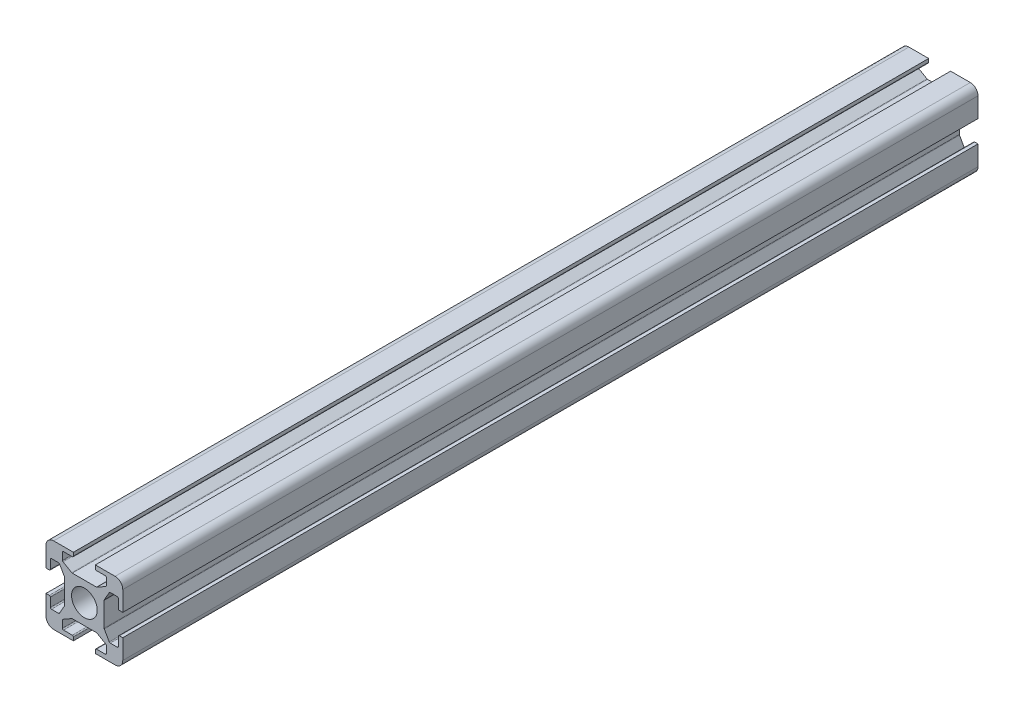
from build123d import *

# Parameters (mm, degrees)
CROQUIS1_R              = 5.85
SALIENTE_EXTRUIR1_DEPTH = 390


with BuildPart() as part:
    # Croquis1 → Saliente-Extruir1 (new body)
    with BuildSketch(Plane.XY):
        with BuildLine():
            Line((-16, -5), (-17.5, -5))
            Line((-17.5, -5), (-17.5, -14))
            ThreePointArc((-17.5, -14), (-16.474873734, -16.474873734), (-14, -17.5))
            Line((-14, -17.5), (-5, -17.5))
            Line((-5, -17.5), (-5, -16))
            ThreePointArc((-5, -16), (-5.146446609, -15.646446609), (-5.5, -15.5))
            Line((-5.5, -15.5), (-9.5, -15.5))
            ThreePointArc((-9.5, -15.5), (-9.853553391, -15.353553391), (-10, -15))
            Line((-10, -15), (-10, -11.790147321))
            ThreePointArc((-10, -11.790147321), (-9.932460283, -11.539192936), (-9.748087586, -11.356036103))
            Line((-9.748087586, -11.356036103), (-5.740718013, -9.065888782))
            ThreePointArc((-5.740718013, -9.065888782), (-5.620974478, -9.016752854), (-5.492630427, -9))
            Line((-5.492630427, -9), (5.492630427, -9))
            ThreePointArc((5.492630427, -9), (5.620974478, -9.016752854), (5.740718013, -9.065888782))
            Line((5.740718013, -9.065888782), (9.748087586, -11.356036103))
            ThreePointArc((9.748087586, -11.356036103), (9.932460283, -11.539192936), (10, -11.790147321))
            Line((10, -11.790147321), (10, -15))
            ThreePointArc((10, -15), (9.853553391, -15.353553391), (9.5, -15.5))
            Line((9.5, -15.5), (5.5, -15.5))
            ThreePointArc((5.5, -15.5), (5.146446609, -15.646446609), (5, -16))
            Line((5, -16), (5, -17.5))
            Line((5, -17.5), (14, -17.5))
            ThreePointArc((14, -17.5), (16.474873734, -16.474873734), (17.5, -14))
            Line((17.5, -14), (17.5, -5))
            Line((17.5, -5), (16, -5))
            ThreePointArc((16, -5), (15.646446609, -5.146446609), (15.5, -5.5))
            Line((15.5, -5.5), (15.5, -9.5))
            ThreePointArc((15.5, -9.5), (15.353553391, -9.853553391), (15, -10))
            Line((15, -10), (11.790147321, -10))
            ThreePointArc((11.790147321, -10), (11.539192936, -9.932460283), (11.356036103, -9.748087586))
            Line((11.356036103, -9.748087586), (9.065888782, -5.740718013))
            ThreePointArc((9.065888782, -5.740718013), (9.016752854, -5.620974478), (9, -5.492630427))
            Line((9, -5.492630427), (9, 5.492630427))
            ThreePointArc((9, 5.492630427), (9.016752854, 5.620974478), (9.065888782, 5.740718013))
            Line((9.065888782, 5.740718013), (11.356036103, 9.748087586))
            ThreePointArc((11.356036103, 9.748087586), (11.539192936, 9.932460283), (11.790147321, 10))
            Line((11.790147321, 10), (15, 10))
            ThreePointArc((15, 10), (15.353553391, 9.853553391), (15.5, 9.5))
            Line((15.5, 9.5), (15.5, 5.5))
            ThreePointArc((15.5, 5.5), (15.646446609, 5.146446609), (16, 5))
            Line((16, 5), (17.5, 5))
            Line((17.5, 5), (17.5, 14))
            ThreePointArc((17.5, 14), (16.474873734, 16.474873734), (14, 17.5))
            Line((14, 17.5), (5, 17.5))
            Line((5, 17.5), (5, 16))
            ThreePointArc((5, 16), (5.146446609, 15.646446609), (5.5, 15.5))
            Line((5.5, 15.5), (9, 15.5))
            Line((9, 15.5), (9.5, 15.5))
            ThreePointArc((9.5, 15.5), (9.853553391, 15.353553391), (10, 15))
            Line((10, 15), (10, 11.790147321))
            ThreePointArc((10, 11.790147321), (9.932460283, 11.539192936), (9.748087586, 11.356036103))
            Line((9.748087586, 11.356036103), (5.740718013, 9.065888782))
            ThreePointArc((5.740718013, 9.065888782), (5.620974478, 9.016752854), (5.492630427, 9))
            Line((5.492630427, 9), (-5.492630427, 9))
            ThreePointArc((-5.492630427, 9), (-5.620974478, 9.016752854), (-5.740718013, 9.065888782))
            Line((-5.740718013, 9.065888782), (-9.748087586, 11.356036103))
            ThreePointArc((-9.748087586, 11.356036103), (-9.932460283, 11.539192936), (-10, 11.790147321))
            Line((-10, 11.790147321), (-10, 15))
            ThreePointArc((-10, 15), (-9.853553391, 15.353553391), (-9.5, 15.5))
            Line((-9.5, 15.5), (-9, 15.5))
            Line((-9, 15.5), (-5.5, 15.5))
            ThreePointArc((-5.5, 15.5), (-5.146446609, 15.646446609), (-5, 16))
            Line((-5, 16), (-5, 17.5))
            Line((-5, 17.5), (-14, 17.5))
            ThreePointArc((-14, 17.5), (-16.474873734, 16.474873734), (-17.5, 14))
            Line((-17.5, 14), (-17.5, 5))
            Line((-17.5, 5), (-16, 5))
            ThreePointArc((-16, 5), (-15.646446609, 5.146446609), (-15.5, 5.5))
            Line((-15.5, 5.5), (-15.5, 9.5))
            ThreePointArc((-15.5, 9.5), (-15.353553391, 9.853553391), (-15, 10))
            Line((-15, 10), (-11.790147321, 10))
            ThreePointArc((-11.790147321, 10), (-11.539192936, 9.932460283), (-11.356036103, 9.748087586))
            Line((-11.356036103, 9.748087586), (-9.065888782, 5.740718013))
            ThreePointArc((-9.065888782, 5.740718013), (-9.016752854, 5.620974478), (-9, 5.492630427))
            Line((-9, 5.492630427), (-9, -5.492630427))
            ThreePointArc((-9, -5.492630427), (-9.016752854, -5.620974478), (-9.065888782, -5.740718013))
            Line((-9.065888782, -5.740718013), (-11.356036103, -9.748087586))
            ThreePointArc((-11.356036103, -9.748087586), (-11.539192936, -9.932460283), (-11.790147321, -10))
            Line((-11.790147321, -10), (-15, -10))
            ThreePointArc((-15, -10), (-15.353553391, -9.853553391), (-15.5, -9.5))
            Line((-15.5, -9.5), (-15.5, -5.5))
            ThreePointArc((-15.5, -5.5), (-15.646446609, -5.146446609), (-16, -5))
        make_face()
        Circle(CROQUIS1_R, mode=Mode.SUBTRACT)
    extrude(amount=SALIENTE_EXTRUIR1_DEPTH)


solid = part.part
